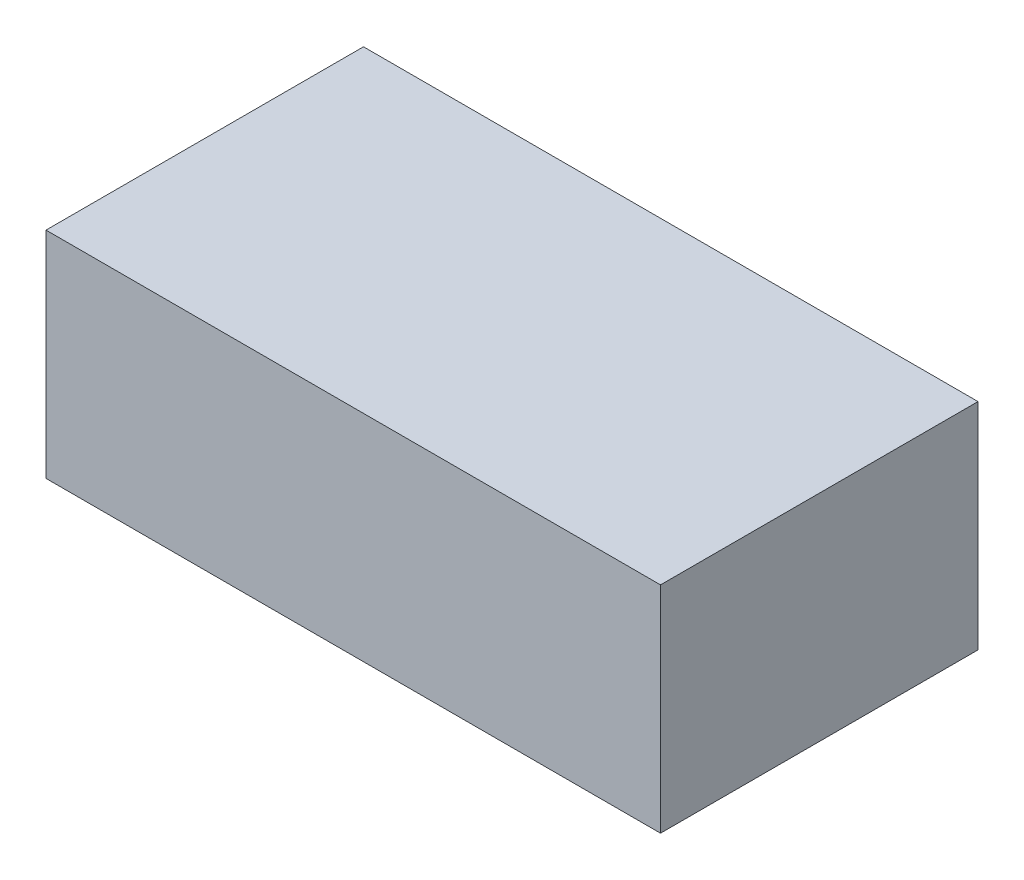
from build123d import *

# Parameters (mm, degrees)
SKETCH1_W           = 59.999999888
SKETCH1_H           = 30.999999976
BOSS_EXTRUDE1_DEPTH = 20.99999991


with BuildPart() as part:
    # Sketch1 → Boss-Extrude1 (new body)
    with BuildSketch(Plane(origin=(0, 0, 0), x_dir=(1, 0, 0), z_dir=(0, 1, 0))):
        with Locations((29.999999944, 15.499999988)):
            Rectangle(SKETCH1_W, SKETCH1_H)
    extrude(amount=BOSS_EXTRUDE1_DEPTH)


solid = part.part
